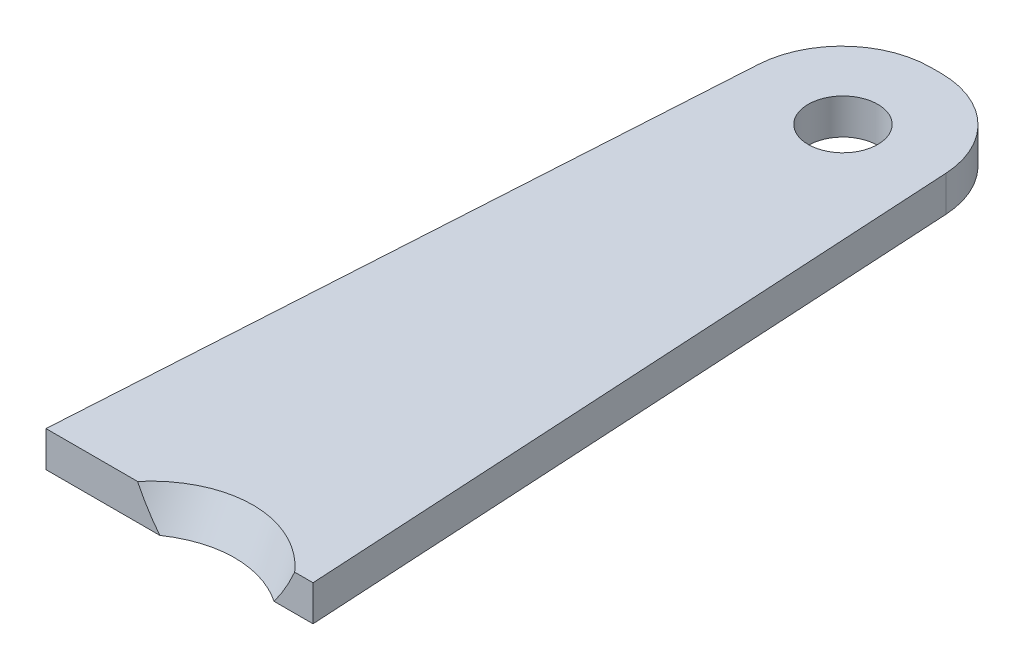
from build123d import *

# Parameters (mm, degrees)
SKETCH1_R           = 3.911052803
BOSS_EXTRUDE1_DEPTH = 4
CAVITY1_OUTLINE_W   = 12.415
CAVITY1_OUTLINE_H   = 5.700748897


# Read off the part's stored shape, not the designer's step: Cavity1
with BuildPart() as part:
    # Sketch1 → Boss-Extrude1 (new body)
    with BuildSketch(Plane(origin=(0, 0, 0), x_dir=(1, 0, 0), z_dir=(0, 1, 0))):
        with BuildLine():
            Line((0, 0), (30, 0))
            Line((30, 0), (25.709430043, 75.411524479))
            ThreePointArc((25.709430043, 75.411524479), (22.592877256, 82.112613927), (15.725576294, 84.84348898))
            Line((15.725576294, 84.84348898), (15.172794511, 84.84348898))
            Line((15.172794511, 84.84348898), (14.566572295, 84.84348898))
            ThreePointArc((14.566572295, 84.84348898), (7.713312448, 82.125853257), (4.584985356, 75.450054873))
            Line((4.584985356, 75.450054873), (0, 0))
        make_face()
        with Locations(Location((15.172794511, 74.362549593, 0), (0, 0, 270))):
            Circle(SKETCH1_R, mode=Mode.SUBTRACT)
    extrude(amount=BOSS_EXTRUDE1_DEPTH)

    # Cavity1 outline → Cavity1 (revolve, cut)
    with BuildSketch(Plane(origin=(19.189357323, 5.518997389, 9.104198025), x_dir=(0.9996334354377989, 0.02380958372693479, -0.012887919831146358), z_dir=(0, -0.47602788353146924, -0.8794301871669804))):
        with Locations((6.2075, -2.156922497)):
            Rectangle(CAVITY1_OUTLINE_W, CAVITY1_OUTLINE_H)
    revolve(axis=Axis((19.189357323, 5.518997389, 9.104198025), (0.027073875873690006, -0.8791078192254351, 0.47585338857874704)), mode=Mode.SUBTRACT)


solid = part.part
